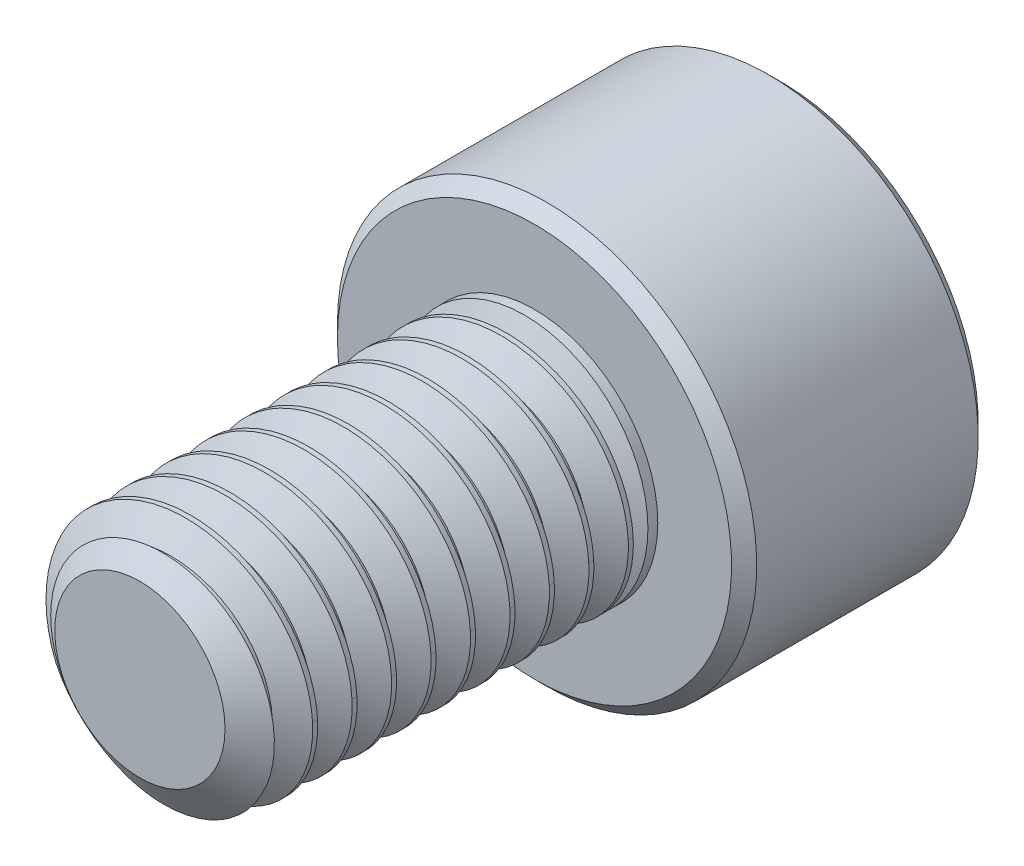
from build123d import *

# Parameters (mm, degrees)
SKETCH1_R          = 2.5
EXTRUDE1_DEPTH     = 8
CUT_SWEEP1_PITCH   = 0.8
SKETCH6_R          = 4.25
EXTRUDE2_DEPTH     = 5
CUT_EXTRUDE1_DEPTH = 3
CHAMFER1_SIZE      = 0.255


with BuildPart() as part:
    # Sketch1 → Extrude1 (new body)
    with BuildSketch(Plane.XY):
        Circle(SKETCH1_R)
    extrude(amount=-EXTRUDE1_DEPTH)

    # Cut-Sweep1: the profile of Sketch3 profile screwed along a right-hand helix of 11 turns, 6 arcs to a turn; built about Z, then put on its axis
    cut_sweep1_z = Axis((0, 0, 0), (0, 0, 1))
    cut_sweep1_corners = [(2.5003, 0, -0.700173205), (1.980384758, 0, -0.4), (1.980384758, 0, -0.3), (2.5003, 0, 0.000173205)]
    with BuildLine(mode=Mode.PRIVATE) as cut_sweep1_profile:
        Line(cut_sweep1_corners[0], cut_sweep1_corners[1])
        Line(cut_sweep1_corners[1], cut_sweep1_corners[2])
        Line(cut_sweep1_corners[2], cut_sweep1_corners[3])
        Line(cut_sweep1_corners[3], cut_sweep1_corners[0])
    cut_sweep1_cap = Face(cut_sweep1_profile.wire())
    cut_sweep1_turn_angles = [0, 30, 60, 90, 120, 150, 180, 210, 240, 270, 300, 330, 360]
    cut_sweep1_turn_weights = [1, 0.8660254037844387, 1, 0.8660254037844387, 1, 0.8660254037844387, 1, 0.8660254037844387, 1, 0.8660254037844387, 1, 0.8660254037844387, 1]
    cut_sweep1_turn_rails = [Edge.make_bspline([Vector(p[0], p[1], 0).rotate(cut_sweep1_z, cut_sweep1_turn_angles[k]) / cut_sweep1_turn_weights[k] + Vector(0, 0, p[2] + CUT_SWEEP1_PITCH * cut_sweep1_turn_angles[k] / 360) for k in range(13)], [0, 0, 0, 1, 1, 2, 2, 3, 3, 4, 4, 5, 5, 6, 6, 6], 2, cut_sweep1_turn_weights) for p in cut_sweep1_corners]
    cut_sweep1_turn_sides = [Face.make_surface_from_curves(cut_sweep1_turn_rails[p[0]], cut_sweep1_turn_rails[p[1]]) for p in [(0, 1), (1, 2), (2, 3), (3, 0)]]
    cut_sweep1 = Plane(origin=(0, 0, 0), x_dir=(0, 1, 0), z_dir=(0, 0, -1)) * Solid(Shell([*[p.moved(Location((0, 0, CUT_SWEEP1_PITCH * i))) for i in range(11) for p in cut_sweep1_turn_sides], cut_sweep1_cap, cut_sweep1_cap.rotate(cut_sweep1_z, 3960).moved(Location((0, 0, CUT_SWEEP1_PITCH * 3960 / 360)))]))
    add(cut_sweep1, mode=Mode.SUBTRACT)

    # Sketch4 → Cut-Revolve1 (revolve, cut)
    with BuildSketch(Plane(origin=(0, 0, 0), x_dir=(0, 0, -1), z_dir=(1, 0, 0)), mode=Mode.PRIVATE) as cut_revolve1_sk:
        Polygon((0.541691224, 2.5), (0, 1.726384758), (0, 2.5), align=None)
    revolve(cut_revolve1_sk.sketch.rotate(Axis((0, 0, 0), (0, 0, -1)), 260.43858876), axis=Axis((0, 0, 0), (0, 0, -1)), mode=Mode.SUBTRACT)

    # Sketch6 → Extrude2 (add)
    with BuildSketch(Plane(origin=(0, 0, -8), x_dir=(-1, 0, 0), z_dir=(0, 0, -1))):
        Circle(SKETCH6_R)
    extrude(amount=EXTRUDE2_DEPTH)

    # Sketch7 → Cut-Extrude1 (cut)
    with BuildSketch(Plane(origin=(0, 0, -13), x_dir=(-1, 0, 0), z_dir=(0, 0, -1))):
        Polygon((0, 2.309401077), (-2, 1.154700538), (-2, -1.154700538), (0, -2.309401077), (2, -1.154700538), (2, 1.154700538), align=None)
    extrude(amount=-CUT_EXTRUDE1_DEPTH, mode=Mode.SUBTRACT)

    # Cut-Extrude2 cone 1 section (through the dimple's axis) → Cut-Extrude2 (revolve, cut)
    with BuildSketch(Plane(origin=(0, 0, -13), x_dir=(0, 1, 0), z_dir=(1, 0, 0))):
        Polygon((0, 0), (2.309401077, 0), (0, 2.309401077), align=None)
    revolve(axis=Axis((0, 0, -13), (0, 0, 1)), mode=Mode.SUBTRACT)

    # Chamfer1
    chamfer1_edges = [part.edges().sort_by_distance(p)[0] for p in [
        (4.25, 0, -8),
        (4.25, 0, -13),
    ]]
    chamfer(chamfer1_edges, length=CHAMFER1_SIZE)

    # Sketch10 → Revolve1 (revolve)
    with BuildSketch(Plane(origin=(0, 0, 0), x_dir=(0, 0, -1), z_dir=(1, 0, 0)), mode=Mode.PRIVATE) as revolve1_sk:
        Polygon((8, 2.5), (8, 0), (6.764466094, 0), (7.8, 2.5), align=None)
    revolve(revolve1_sk.sketch.rotate(Axis((0, 0, -8), (0, 0, 1)), 270), axis=Axis((0, 0, -8), (0, 0, 1)))


solid = part.part
